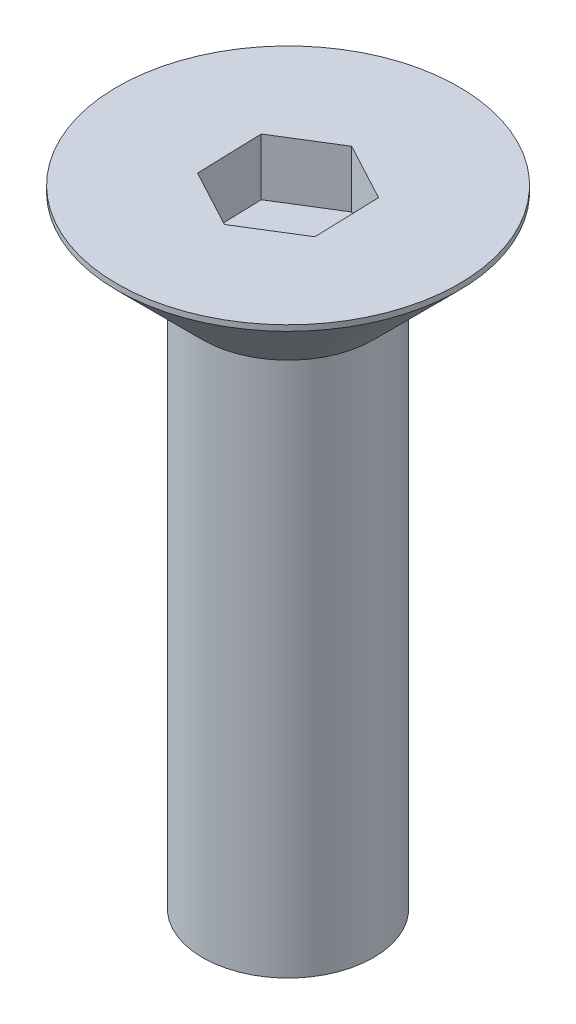
from build123d import *

# Parameters (mm, degrees)
SKETCH_1_R          = 1.5
EXTRUDE_1_DEPTH     = 8
SKETCH_2_R          = 3
EXTRUDE_2_DEPTH     = 3
CHAMFER_1_SIZE      = 2.9
CUT_EXTRUDE_1_DEPTH = 1


with BuildPart() as part:
    # 草图1 → 凸台-拉伸1 (new body)
    with BuildSketch(Plane(origin=(0, 0, 0), x_dir=(1, 0, 0), z_dir=(0, 1, 0))):
        with Locations(Location((0, 0, 0), (0, 0, 270))):
            Circle(SKETCH_1_R)
    extrude(amount=EXTRUDE_1_DEPTH)

    # 草图2 → 凸台-拉伸2 (add)
    with BuildSketch(Plane(origin=(0, 8, 0), x_dir=(1, 0, 0), z_dir=(0, 1, 0))):
        with Locations(Location((0, 0, 0), (0, 0, 270))):
            Circle(SKETCH_2_R)
    extrude(amount=EXTRUDE_2_DEPTH)

    # 倒角1
    # the kernel refuses this chamfer: 2.9 mm, written as the material it takes off along each edge
    with BuildSketch(Plane(origin=(0, 8, 0), x_dir=(0, 0, 1), z_dir=(-1, 0, 0))) as chamfer_1_piece_1_section:
        Polygon((3, CHAMFER_1_SIZE), (3 - CHAMFER_1_SIZE, 0), (3, 0), align=None)
    chamfer_1_piece_1 = revolve(axis=Axis((0, 8, 0), (0, 1, 0)), mode=Mode.PRIVATE)
    chamfer_1_piece_1 = chamfer_1_piece_1 - Plane(origin=(0, 10.16453564, 0), x_dir=(0, 0, 1), z_dir=(0, -1, 0)) * Cylinder(1.5, 12, mode=Mode.PRIVATE)
    add(chamfer_1_piece_1, mode=Mode.SUBTRACT)

    # 草图3 → 切除-拉伸1 (cut)
    with BuildSketch(Plane(origin=(0, 11, 0), x_dir=(1, 0, 0), z_dir=(0, 1, 0))):
        Polygon((1.017530084, -0.545862493), (0.981495828, 0.608275655), (-0.036034256, 1.154138148), (-1.017530084, 0.545862493), (-0.981495828, -0.608275655), (0.036034256, -1.154138148), align=None)
    extrude(amount=-CUT_EXTRUDE_1_DEPTH, mode=Mode.SUBTRACT)


solid = part.part
